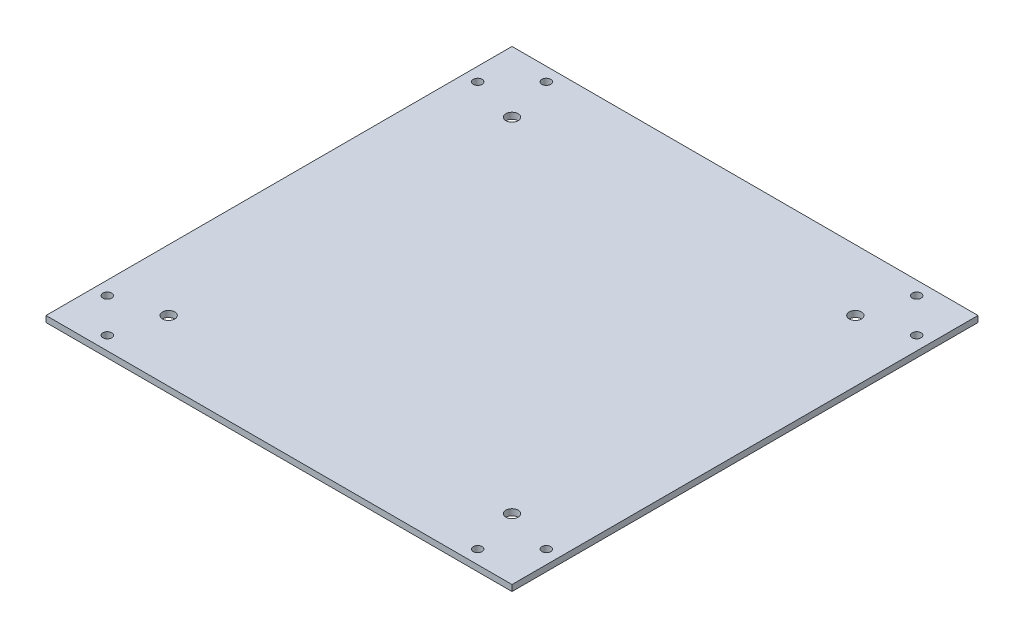
from build123d import *

# Parameters (mm, degrees)
SKETCH1_W           = 241.3
SKETCH1_H           = 241.3
BOSS_EXTRUDE1_DEPTH = 3.175
SKETCH2_R           = 2.286
SKETCH2_R_2         = 3.175
CUT_EXTRUDE1_DEPTH  = 342.264502439


with BuildPart() as part:
    # Sketch1 → Boss-Extrude1 (new body)
    with BuildSketch(Plane(origin=(0, 0, 0), x_dir=(1, 0, 0), z_dir=(0, 1, 0))):
        with Locations((120.65, 120.65)):
            Rectangle(SKETCH1_W, SKETCH1_H)
    extrude(amount=BOSS_EXTRUDE1_DEPTH)

    # Sketch2 → Cut-Extrude1 (cut, through all)
    with BuildSketch(Plane(origin=(0, 3.175, 0), x_dir=(1, 0, 0), z_dir=(0, 1, 0))):
        with Locations((234.315, 24.765)):
            Circle(SKETCH2_R)
        with Locations((216.535, 6.985)):
            Circle(SKETCH2_R)
        with Locations((6.985, 24.765)):
            Circle(SKETCH2_R)
        with Locations((24.765, 6.985)):
            Circle(SKETCH2_R)
        with Locations((24.765, 234.315)):
            Circle(SKETCH2_R)
        with Locations((6.985, 216.535)):
            Circle(SKETCH2_R)
        with Locations((234.315, 216.535)):
            Circle(SKETCH2_R)
        with Locations((216.535, 234.315)):
            Circle(SKETCH2_R)
        with Locations((209.55, 31.75)):
            Circle(SKETCH2_R_2)
        with Locations((31.75, 31.75)):
            Circle(SKETCH2_R_2)
        with Locations((31.75, 209.55)):
            Circle(SKETCH2_R_2)
        with Locations((209.55, 209.55)):
            Circle(SKETCH2_R_2)
    extrude(amount=-CUT_EXTRUDE1_DEPTH, mode=Mode.SUBTRACT)


solid = part.part
